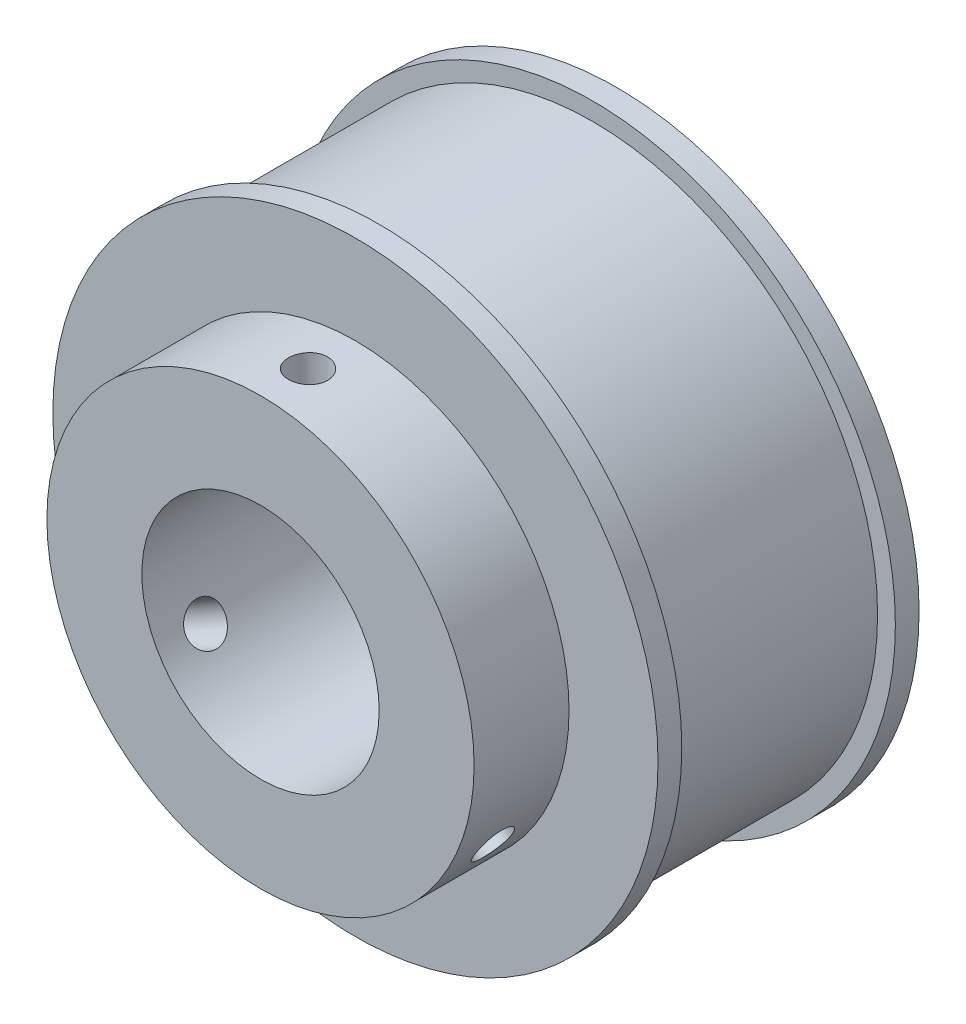
from build123d import *
from build123d.topology import SkipClean

# Parameters (mm, degrees)
SKETCH1_R                   = 24
BOSS_EXTRUDE1_DEPTH         = 18
SKETCH2_R                   = 25.5
BOSS_EXTRUDE2_DEPTH         = 2
BOSS_EXTRUDE3_START         = -20
SKETCH2_2_R                 = 25.5
BOSS_EXTRUDE3_DEPTH         = 2
F_20_0MM_DOWEL_HOLE1_D      = 20
SKETCH13_R                  = 18
SKETCH13_R_2                = 10
BOSS_EXTRUDE4_DEPTH         = 8
SKETCH16_W                  = 1.65
SKETCH16_H                  = 25.5
TAP_DRILL_FOR_M4_TAP3_D     = 3.3
TAP_DRILL_FOR_M4_TAP3_DEPTH = 16.83
TAP_DRILL_FOR_M4_TAP3_TIP   = 0.991420021
TAP_DRILL_FOR_M4_TAP4_D     = 3.3
TAP_DRILL_FOR_M4_TAP4_DEPTH = 16.83
TAP_DRILL_FOR_M4_TAP4_TIP   = 0.991420021


with BuildPart() as part:
    # Sketch1 → Boss-Extrude1 (new body)
    with BuildSketch(Plane.XY):
        Circle(SKETCH1_R)
    extrude(amount=BOSS_EXTRUDE1_DEPTH)

    # Sketch2 → Boss-Extrude2 (add)
    with BuildSketch(Plane.XY.offset(18)):
        Circle(SKETCH2_R)
    extrude(amount=BOSS_EXTRUDE2_DEPTH)

    # Sketch2<2> → Boss-Extrude3 (add)
    with BuildSketch(Plane.XY.offset(18).offset(BOSS_EXTRUDE3_START)):
        Circle(SKETCH2_2_R)
    extrude(amount=BOSS_EXTRUDE3_DEPTH)

    # Ø20.0mm Dowel Hole1 (through all)
    with Locations(Plane.XY.offset(20)):
        with Locations((0, 0)):
            Hole(F_20_0MM_DOWEL_HOLE1_D / 2)

    # Sketch13 → Boss-Extrude4 (add)
    with SkipClean():  # the faces are left unmerged after this step: merging them gives an invalid solid
        with BuildSketch(Plane.XY.offset(20)):
            Circle(SKETCH13_R)
            Circle(SKETCH13_R_2, mode=Mode.SUBTRACT)
        extrude(amount=BOSS_EXTRUDE4_DEPTH)
    add(part.part.scale(1), mode=Mode.REPLACE)  # the faces are merged on a copy

    # Sketch16 → Tap Drill for M4 Tap1 (revolve, cut)
    with BuildSketch(Plane(origin=(0, 0, 24), x_dir=(0, 0, -1), z_dir=(1, 0, 0))):
        with Locations((0.825, 12.75)):
            Rectangle(SKETCH16_W, SKETCH16_H)
    revolve(axis=Axis((0, -6.35, 24), (0, 1, 0)), mode=Mode.SUBTRACT)

    # Tap Drill for M4 Tap3
    with Locations(Plane(origin=(-15.588457268, -9, 0), x_dir=(0, 0, -1), z_dir=(-0.8660254037844433, -0.49999999999999195, 0))):
        with Locations((-24, 0)):
            Hole(TAP_DRILL_FOR_M4_TAP3_D / 2, depth=TAP_DRILL_FOR_M4_TAP3_DEPTH)
            with Locations((0, 0, -(TAP_DRILL_FOR_M4_TAP3_DEPTH + TAP_DRILL_FOR_M4_TAP3_TIP / 2))):  # 118° drill point
                Cone(0, TAP_DRILL_FOR_M4_TAP3_D / 2, TAP_DRILL_FOR_M4_TAP3_TIP, mode=Mode.SUBTRACT)

    # Tap Drill for M4 Tap4
    with Locations(Plane(origin=(15.588457268, -9, 0), x_dir=(0, 0, -1), z_dir=(0.8660254037844364, -0.5000000000000041, 0))):
        with Locations((-24, 0)):
            Hole(TAP_DRILL_FOR_M4_TAP4_D / 2, depth=TAP_DRILL_FOR_M4_TAP4_DEPTH)
            with Locations((0, 0, -(TAP_DRILL_FOR_M4_TAP4_DEPTH + TAP_DRILL_FOR_M4_TAP4_TIP / 2))):  # 118° drill point
                Cone(0, TAP_DRILL_FOR_M4_TAP4_D / 2, TAP_DRILL_FOR_M4_TAP4_TIP, mode=Mode.SUBTRACT)


solid = part.part
